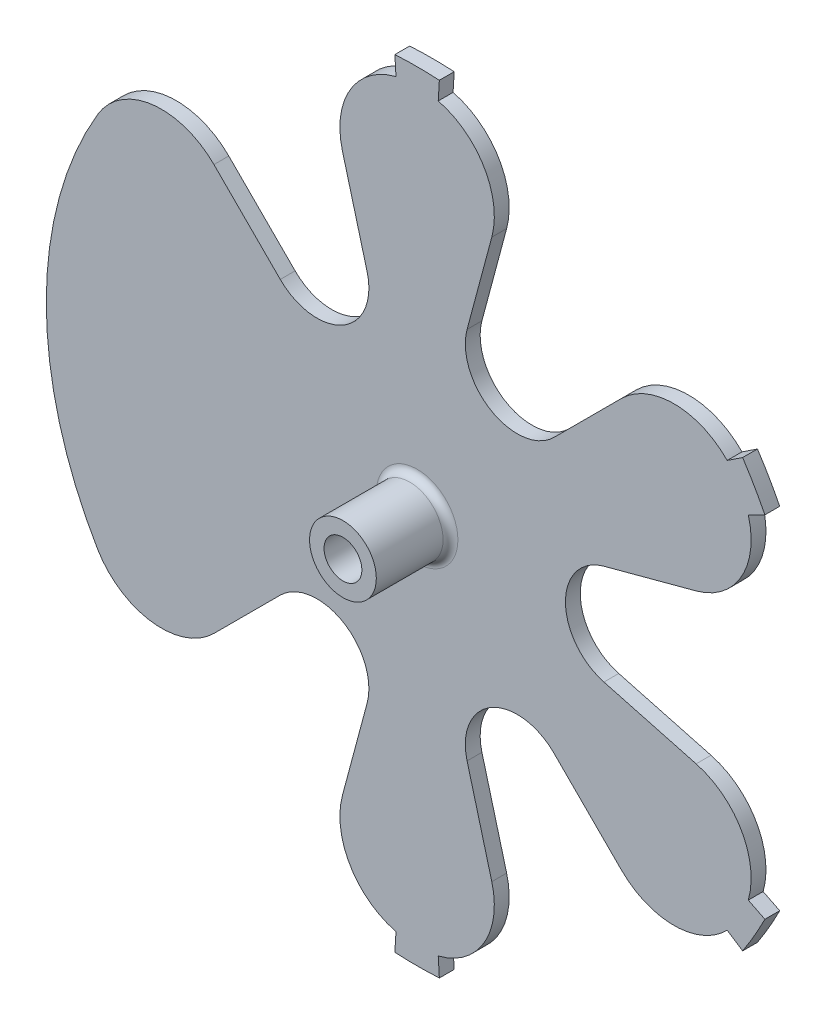
from build123d import *

# Parameters (mm, degrees)
SKETCH1_R                       = 50
BOSS_EXTRUDE1_DEPTH             = 2
BOSS_EXTRUDE3_START             = -2
BOSS_EXTRUDE3_DEPTH             = 2
SKETCH4_R                       = 4.5
SKETCH4_R_2                     = 2.55
BOSS_EXTRUDE2_DEPTH             = 10
CIRPATTERN2_COUNT               = 4
CIRPATTERN2_ANGLE               = 180
CUT_EXTRUDE2_REACH              = 75.186
CIRPATTERN3_COUNT               = 3
CIRPATTERN3_ANGLE               = 120
CIRPATTERN3_THE_OTHER_WAY_COUNT = 3
CIRPATTERN3_THE_OTHER_WAY_ANGLE = 120
FILLET1_R                       = 10
FILLET2_R                       = 1


with BuildPart() as part:
    # Sketch1 → Boss-Extrude1 (new body)
    with BuildSketch(Plane.XY):
        Circle(SKETCH1_R)
    extrude(amount=BOSS_EXTRUDE1_DEPTH)

    # Sketch5 → Boss-Extrude3 (add)
    with BuildSketch(Plane.XY.offset(2).offset(BOSS_EXTRUDE3_START)):
        with BuildLine():
            Line((-2.847377425, 49.918858579), (-3, 52.414215629))
            ThreePointArc((-3, 52.414215629), (0, 52.5), (3, 52.414215629))
            Line((3, 52.414215629), (2.847377425, 49.918858579))
            ThreePointArc((2.847377425, 49.918858579), (0, 50), (-2.847377425, 49.918858579))
        make_face()
    boss_extrude3 = extrude(amount=BOSS_EXTRUDE3_DEPTH)

    # Sketch4 → Boss-Extrude2 (add)
    with BuildSketch(Plane.XY.offset(2)):
        Circle(SKETCH4_R)
        Circle(SKETCH4_R_2, mode=Mode.SUBTRACT)
    extrude(amount=BOSS_EXTRUDE2_DEPTH)

    # CirPattern2: Boss-Extrude3 ×4 about axis
    cirpattern2_axis = Axis((0, 0, 0), (0, 0, -1))
    for i in range(1, CIRPATTERN2_COUNT):
        add(boss_extrude3.rotate(cirpattern2_axis, i * CIRPATTERN2_ANGLE / (CIRPATTERN2_COUNT - 1)))

    # Sketch7 → Cut-Extrude2 (cut, up to next)
    with BuildSketch(Plane.XY.offset(2), mode=Mode.PRIVATE) as cut_extrude2_sk1:
        with BuildLine():
            Line((48.293213683, 12.952432674), (25.188266684, 6.761480784))
            ThreePointArc((25.188266684, 6.761480784), (20, 0), (25.188266684, -6.761480784))
            Line((25.188266684, -6.761480784), (48.293213683, -12.952432674))
            ThreePointArc((48.293213683, -12.952432674), (50, 0), (48.293213683, 12.952432674))
        make_face()
    cut_extrude2_tool1 = extrude(cut_extrude2_sk1.sketch, amount=-CUT_EXTRUDE2_REACH, mode=Mode.PRIVATE) & part.part
    cut_extrude2 = cut_extrude2_tool1.solids().sort_by_distance((37.115477, 0, 2))[0]
    add(cut_extrude2, mode=Mode.SUBTRACT)

    # CirPattern3: Cut-Extrude2 ×3 about axis
    cirpattern3_axis = Axis((0, 0, 0), (0, 0, 1))
    for i in range(1, CIRPATTERN3_COUNT):
        add(cut_extrude2.rotate(cirpattern3_axis, i * CIRPATTERN3_ANGLE / (CIRPATTERN3_COUNT - 1)), mode=Mode.SUBTRACT)

    # CirPattern3 the other way: Cut-Extrude2 ×3 about axis
    cirpattern3_the_other_way_axis = Axis((0, 0, 0), (0, 0, -1))
    for i in range(1, CIRPATTERN3_THE_OTHER_WAY_COUNT):
        add(cut_extrude2.rotate(cirpattern3_the_other_way_axis, i * CIRPATTERN3_THE_OTHER_WAY_ANGLE / (CIRPATTERN3_THE_OTHER_WAY_COUNT - 1)), mode=Mode.SUBTRACT)

    # Fillet1
    # the kernel refuses this fillet: 10 mm, written as the material it takes off along each edge
    with BuildSketch(Plane(origin=(-35.363742578, 35.346933543, 33.509652434), x_dir=(-0.6121571340688006, -0.7907361400673886, 0), z_dir=(0, 0, -1))) as fillet1_piece_1:
        with BuildLine():
            CenterArc((11.343474876, -9.920253368), FILLET1_R, 82.759261871, 104.49509636)
            Line((1.423521402, -11.182997629), (1.225122333, -11.208252514))
            Line((1.225122333, -11.208252514), (-0.198399069, -0.025254885))
            Line((-0.198399069, -0.025254885), (-0.025207722, 0.198405067))
            ThreePointArc((-0.025207722, 0.198405067), (6.301930487, 0.59873316), (12.629068696, 0.198405067))
            Line((12.629068696, 0.198405067), (12.603860974, 0))
        make_face()
    extrude(amount=65.019304869, mode=Mode.SUBTRACT)
    with BuildSketch(Plane(origin=(-12.929471105, 48.299366217, 29.609711649), x_dir=(0.9873433189599674, 0.15859751103064706, 0), z_dir=(0, 0, -1))) as fillet1_piece_2:
        with BuildLine():
            CenterArc((11.077824317, 9.96238911), FILLET1_R, 174.125500121, 90.903649981)
            Line((1.130339641, 10.985887341), (0.931389948, 11.006357306))
            Line((0.931389948, 11.006357306), (-0.198949694, 0.020469965))
            Line((-0.198949694, 0.020469965), (-0.020422671, -0.198954554))
            ThreePointArc((-0.020422671, -0.198954554), (5.105667647, -0.46136152), (10.194005514, -0.199247782))
            Line((10.194005514, -0.199247782), (10.211335295, 0))
        make_face()
    extrude(amount=57.219423297, mode=Mode.SUBTRACT)
    with BuildSketch(Plane(origin=(35.363742578, -35.346933543, 29.609711649), x_dir=(0.6310211330095078, 0.775765640960849, 0), z_dir=(0, 0, -1)), Plane(origin=(-12.929471105, -48.299366217, 29.609711649), x_dir=(0.9873433189599667, -0.1585975110306507, 0), z_dir=(0, 0, -1)), Plane(origin=(12.929471105, 48.299366217, 29.609711649), x_dir=(-0.987343318959968, 0.15859751103064254, 0), z_dir=(0, 0, -1)), Plane(origin=(48.293213683, 12.952432674, 29.609711649), x_dir=(-0.35632218595046244, 0.9343631519914962, 0), z_dir=(0, 0, -1))) as fillet1_piece_3:
        with BuildLine():
            CenterArc((11.077824317, -9.96238911), FILLET1_R, 94.970849897, 90.903649981)
            Line((1.130339641, -10.985887341), (0.931389948, -11.006357306))
            Line((0.931389948, -11.006357306), (-0.198949694, -0.020469965))
            Line((-0.198949694, -0.020469965), (-0.020422671, 0.198954554))
            ThreePointArc((-0.020422671, 0.198954554), (5.105667647, 0.46136152), (10.194005514, 0.199247782))
            Line((10.194005514, 0.199247782), (10.211335295, 0))
        make_face()
    extrude(amount=57.219423297, mode=Mode.SUBTRACT)
    with BuildSketch(Plane(origin=(12.929471105, -48.299366217, 29.609711649), x_dir=(-0.2588190451025242, 0.9659258262890674, 0), z_dir=(0, 0, -1)), Plane(origin=(35.363742578, 35.346933543, 29.609711649), x_dir=(-0.7071067811865411, -0.707106781186554, 0), z_dir=(0, 0, -1)), Plane(origin=(48.293213683, -12.952432674, 29.609711649), x_dir=(-0.96592582628907, 0.2588190451025145, 0), z_dir=(0, 0, -1))) as fillet1_piece_4:
        with BuildLine():
            CenterArc((11.043884659, -10), FILLET1_R, 90, 90.903649981)
            Line((1.045128361, -10.157710136), (0.845153235, -10.160864339))
            ThreePointArc((0.845153235, -10.160864339), (0.063625516, -5.126075338), (-0.199999994, -4.7543e-05))
            Line((-0.199999994, -4.7543e-05), (0, 0.2))
            Line((0, 0.2), (11.043884659, 0.2))
            Line((11.043884659, 0.2), (11.043884659, 0))
        make_face()
    extrude(amount=57.219423297, mode=Mode.SUBTRACT)
    with BuildSketch(Plane(origin=(-35.363742578, -35.346933543, 33.509652434), x_dir=(0.7071067811865469, 0.7071067811865481, 0), z_dir=(0, 0, -1))) as fillet1_piece_5:
        with BuildLine():
            CenterArc((11.273235967, -10), FILLET1_R, 90, 104.49509636)
            Line((1.591545311, -12.502971446), (1.397911498, -12.553030874))
            ThreePointArc((1.397911498, -12.553030874), (0.201832147, -6.327090409), (-0.199999994, -4.7543e-05))
            Line((-0.199999994, -4.7543e-05), (0, 0.2))
            Line((0, 0.2), (11.273235967, 0.2))
            Line((11.273235967, 0.2), (11.273235967, 0))
        make_face()
    extrude(amount=65.019304869, mode=Mode.SUBTRACT)

    # Fillet2
    fillet2_edges = [part.edges().sort_by_distance(p)[0] for p in [
        (-2.55, 0, 2),
        (-4.5, 0, 2),
    ]]
    fillet(fillet2_edges, radius=FILLET2_R)


solid = part.part
